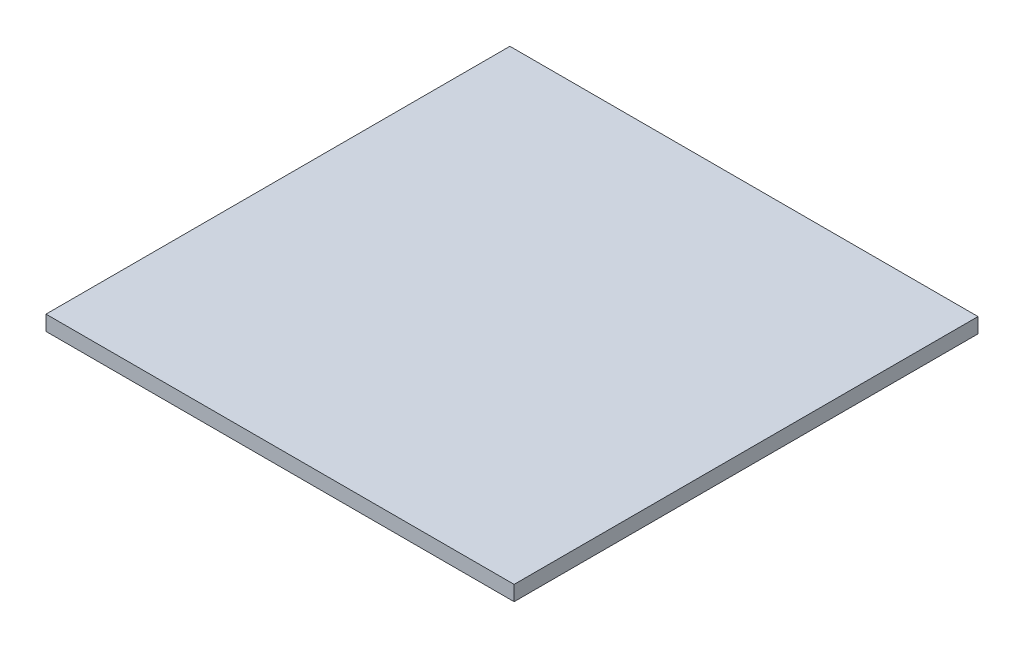
from build123d import *

# Parameters (mm, degrees)
SKETCH1_W           = 99.7
SKETCH1_H           = 98.8
BOSS_EXTRUDE1_DEPTH = 3.2


with BuildPart() as part:
    # Sketch1 → Boss-Extrude1 (new body)
    with BuildSketch(Plane(origin=(0, 0, 0), x_dir=(1, 0, 0), z_dir=(0, 1, 0))):
        with Locations((5.568457944, -28.701985981)):
            Rectangle(SKETCH1_W, SKETCH1_H)
    extrude(amount=BOSS_EXTRUDE1_DEPTH)


solid = part.part
